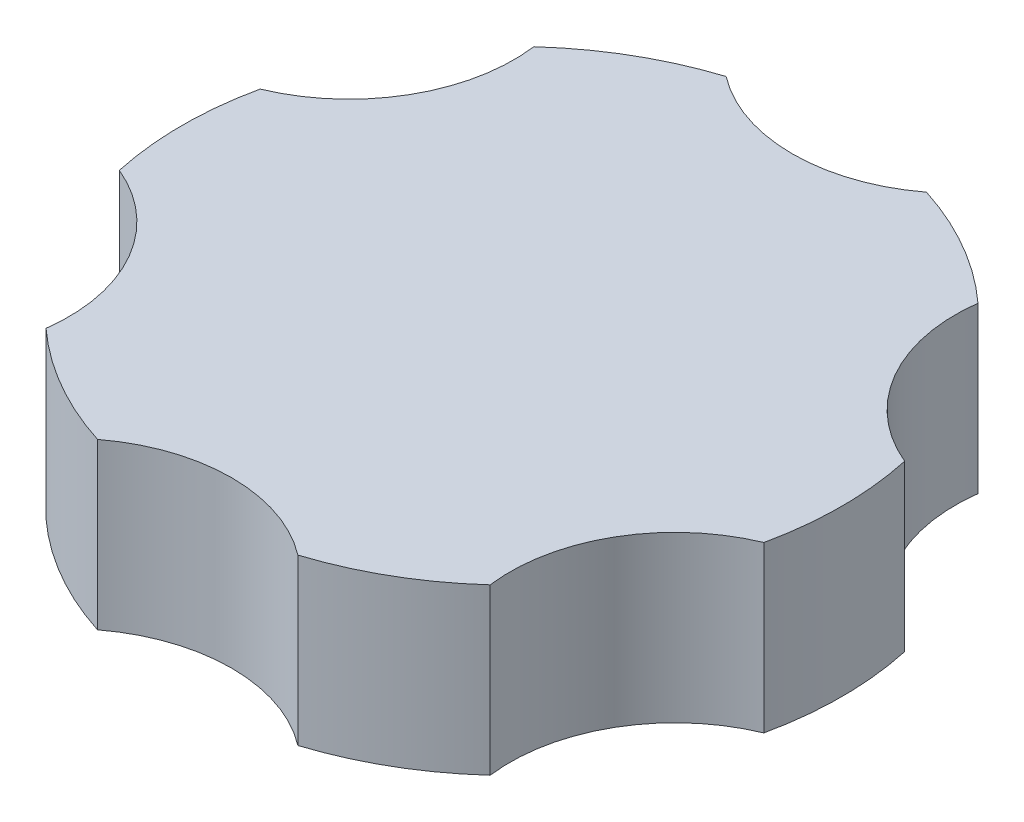
from build123d import *

# Parameters (mm, degrees)
SCHIZZO1_R                   = 20
ESTRUSIONE_ESTRUSIONE1_DEPTH = 10
SCHIZZO2_R                   = 10
TAGLIO_ESTRUSIONE1_DEPTH     = 10
RIPETIZIONECIRCOLARE1_DEPTH  = 10
TAGLIO_ESTRUSIONE2_DEPTH     = 6


# Read off the part's stored shape, not the designer's step: RipetizioneCircolare1
with BuildPart() as part:
    # Schizzo1 → Estrusione-Estrusione1 (new body)
    with BuildSketch(Plane(origin=(0, 0, 0), x_dir=(1, 0, 0), z_dir=(0, 1, 0))):
        with Locations(Location((0, 0, 0), (0, 0, 270))):
            Circle(SCHIZZO1_R)
    extrude(amount=ESTRUSIONE_ESTRUSIONE1_DEPTH)

    # Schizzo2 → Taglio-Estrusione1 (cut)
    with BuildSketch(Plane(origin=(0, 10, 0), x_dir=(1, 0, 0), z_dir=(0, 1, 0))):
        with Locations((0, 27)):
            Circle(SCHIZZO2_R)
    extrude(amount=-TAGLIO_ESTRUSIONE1_DEPTH, mode=Mode.SUBTRACT)

    # RipetizioneCircolare1 outline → RipetizioneCircolare1 (cut)
    with BuildSketch(Plane(origin=(0, 0, 0), x_dir=(1, 0, 0), z_dir=(0, 1, 0))):
        with BuildLine():
            ThreePointArc((-13.465911046, 14.787469009), (-17.320508076, 10), (-19.539279343, 4.268086546))
            ThreePointArc((-19.539279343, 4.268086546), (-14.722431864, 8.5), (-13.465911046, 14.787469009))
        make_face()
        with BuildLine():
            ThreePointArc((13.465911046, 14.787469009), (14.722431864, 8.5), (19.539279343, 4.268086546))
            ThreePointArc((19.539279343, 4.268086546), (17.320508076, 10), (13.465911046, 14.787469009))
        make_face()
        with BuildLine():
            ThreePointArc((19.539279343, -4.268086546), (14.722431864, -8.5), (13.465911046, -14.787469009))
            ThreePointArc((13.465911046, -14.787469009), (17.320508076, -10), (19.539279343, -4.268086546))
        make_face()
        with BuildLine():
            ThreePointArc((6.073368297, -19.055555556), (0, -17), (-6.073368297, -19.055555556))
            ThreePointArc((-6.073368297, -19.055555556), (0, -20), (6.073368297, -19.055555556))
        make_face()
        with BuildLine():
            ThreePointArc((-13.465911046, -14.787469009), (-14.722431864, -8.5), (-19.539279343, -4.268086546))
            ThreePointArc((-19.539279343, -4.268086546), (-17.320508076, -10), (-13.465911046, -14.787469009))
        make_face()
    extrude(amount=RIPETIZIONECIRCOLARE1_DEPTH, mode=Mode.SUBTRACT)

    # Schizzo3 → Taglio-Estrusione2 (cut)
    with BuildSketch(Plane.XZ):
        Polygon((0, 2), (-1.732050808, 1), (-1.732050808, -1), (0, -2), (1.732050808, -1), (1.732050808, 1), align=None)
    extrude(amount=-TAGLIO_ESTRUSIONE2_DEPTH, mode=Mode.SUBTRACT)


solid = part.part
